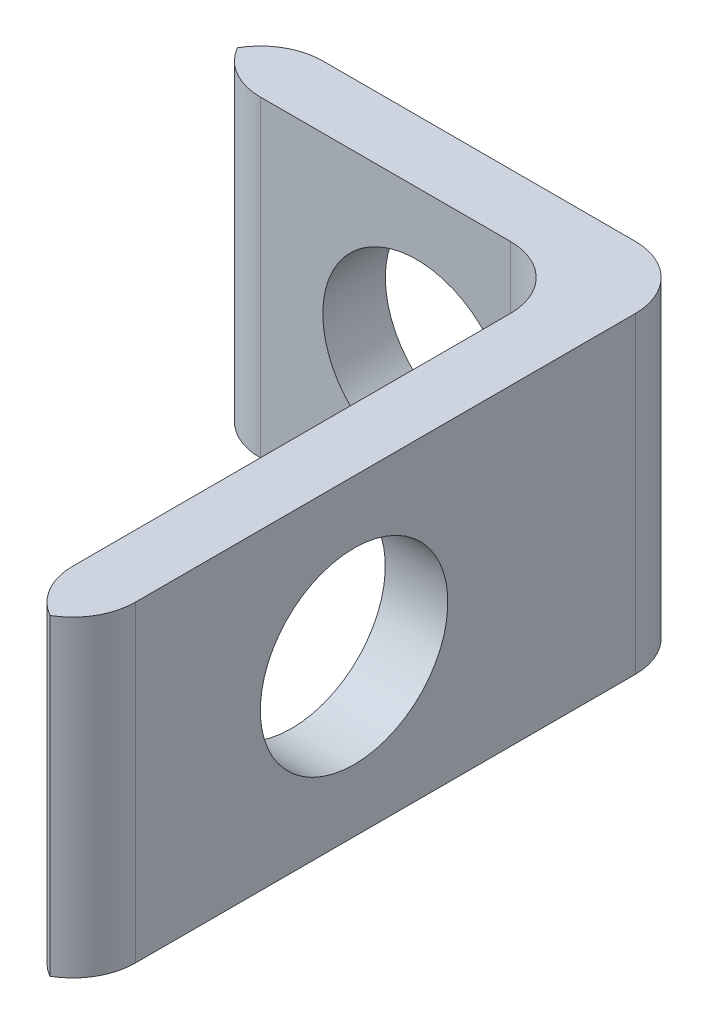
from build123d import *

# Parameters (mm, degrees)
SKETCH1_W           = 7
SKETCH1_H           = 5
SKETCH1_R           = 1.5
BOSS_EXTRUDE1_DEPTH = 1
SKETCH2_W           = 1
SKETCH2_H           = 5
BOSS_EXTRUDE2_DEPTH = 9
SKETCH3_R           = 1.5
CUT_EXTRUDE1_DEPTH  = 1
FILLET1_R           = 1
FILLET2_R           = 1
FILLET3_R           = 1


# Some blends are built 0.0001 mm under size
with BuildPart() as part:
    # Sketch1 → Boss-Extrude1 (new body)
    with BuildSketch(Plane.XY):
        with Locations((3.5, 2.5)):
            Rectangle(SKETCH1_W, SKETCH1_H)
        with Locations((3.5, 2.5)):
            Circle(SKETCH1_R, mode=Mode.SUBTRACT)
    extrude(amount=BOSS_EXTRUDE1_DEPTH)

    # Sketch2 → Boss-Extrude2 (add)
    with BuildSketch(Plane.XY.offset(1)):
        with Locations((6.5, 2.5)):
            Rectangle(SKETCH2_W, SKETCH2_H)
    extrude(amount=BOSS_EXTRUDE2_DEPTH)

    # Sketch3 → Cut-Extrude1 (cut)
    with BuildSketch(Plane.ZY.offset(-6)):
        with Locations(Location((5.5, 2.5, 0), (0, 0, 270))):
            Circle(SKETCH3_R)
    extrude(amount=-CUT_EXTRUDE1_DEPTH, mode=Mode.SUBTRACT)

    # Fillet1
    fillet1_edges = [part.edges().sort_by_distance(p)[0] for p in [
        (6, 2.5, 1),
    ]]
    fillet(fillet1_edges, radius=FILLET1_R - 0.0001)  # a hair under: the kernel refuses the full size

    # Fillet2
    # the kernel refuses this fillet: 1 mm, written as the material it takes off along each edge
    with BuildSketch(Plane(origin=(7, -2.5, 10), x_dir=(-1, 0, 0), z_dir=(0, 1, 0)), Plane(origin=(0, 7.5, 0), x_dir=(0, 0, 1), z_dir=(0, -1, 0)), Plane(origin=(0, 7.5, 1), x_dir=(1, 0, 0), z_dir=(0, -1, 0))) as fillet2_piece_1:
        with BuildLine():
            CenterArc((FILLET2_R, -FILLET2_R), FILLET2_R, 90, 90)
            Line((0, -FILLET2_R), (0, 0))
            Line((0, 0), (FILLET2_R, 0))
        make_face()
    extrude(amount=10, mode=Mode.SUBTRACT)
    with BuildSketch(Plane(origin=(6, 7.5, 10), x_dir=(0, 0, -1), z_dir=(0, -1, 0))) as fillet2_piece_2:
        with BuildLine():
            CenterArc((FILLET2_R, FILLET2_R), FILLET2_R, 180, 90)
            Line((0, FILLET2_R), (0, 0))
            Line((0, 0), (FILLET2_R, 0))
        make_face()
    extrude(amount=10, mode=Mode.SUBTRACT)

    # Fillet3
    fillet3_edges = [part.edges().sort_by_distance(p)[0] for p in [
        (7, 2.5, 0),
    ]]
    fillet(fillet3_edges, radius=FILLET3_R)


solid = part.part
